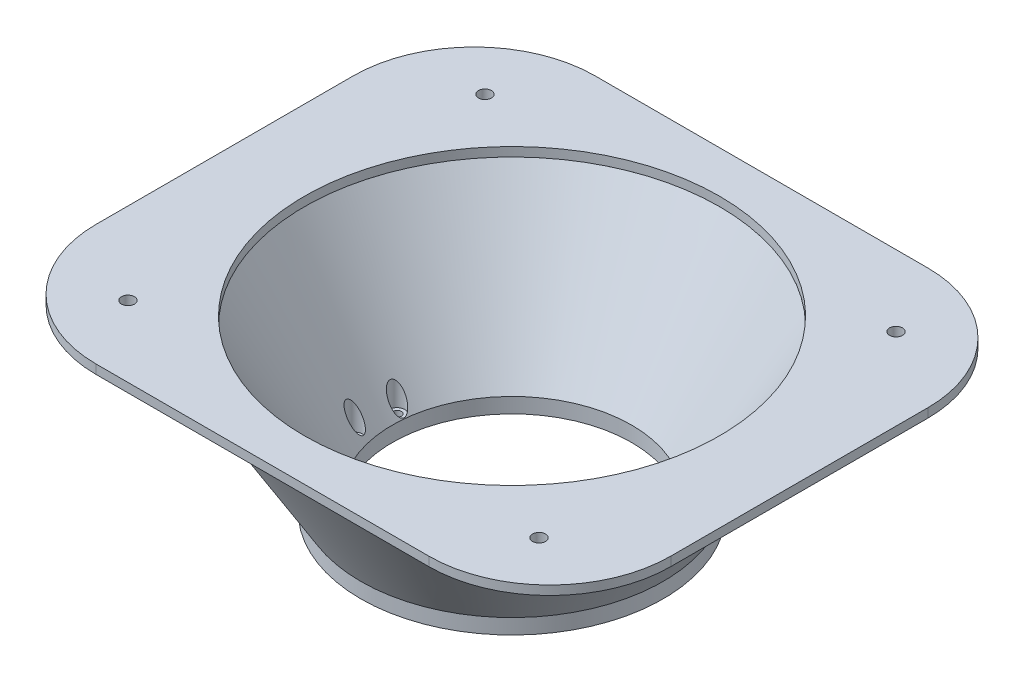
from build123d import *

# Parameters (mm, degrees)
SKETCH4_R           = 50
SKETCH4_R_2         = 39.565
SKETCH4_R_3         = 1.4
BOSS_EXTRUDE3_DEPTH = 5
SKETCH7_W           = 190
SKETCH7_H           = 165
SKETCH7_R           = 68.628897091
SKETCH7_R_2         = 2.15
BOSS_EXTRUDE4_DEPTH = 3
FILLET1_R           = 40
CUT_EXTRUDE1_START  = -5
SKETCH8_R           = 2.5
CUT_EXTRUDE1_DEPTH  = 133.721639549


with BuildPart() as part:
    # Sketch4 → Boss-Extrude3 (new body)
    with BuildSketch(Plane(origin=(0, 0, 0), x_dir=(1, 0, 0), z_dir=(0, 1, 0))):
        Circle(SKETCH4_R)
        Circle(SKETCH4_R_2, mode=Mode.SUBTRACT)
        with Locations((42, -10)):
            Circle(SKETCH4_R_3, mode=Mode.SUBTRACT)
        with Locations((42, 4)):
            Circle(SKETCH4_R_3, mode=Mode.SUBTRACT)
        with Locations((-42, -10)):
            Circle(SKETCH4_R_3, mode=Mode.SUBTRACT)
        with Locations((-42, 4)):
            Circle(SKETCH4_R_3, mode=Mode.SUBTRACT)
    extrude(amount=BOSS_EXTRUDE3_DEPTH)

    # Sketch6 → Revolve1 (revolve)
    with BuildSketch(Plane(origin=(0, 0, 0), x_dir=(0, 0, -1), z_dir=(1, 0, 0))):
        Polygon((-50, 5), (-79.06281292, 53), (-68.62781292, 53), (-39.565, 5), align=None)
    revolve(axis=Axis((0, 0, 0), (0, 1, 0)))

    # Sketch7 → Boss-Extrude4 (add)
    with BuildSketch(Plane(origin=(0, 53, 0), x_dir=(1, 0, 0), z_dir=(0, 1, 0))):
        Rectangle(SKETCH7_W, SKETCH7_H)
        Circle(SKETCH7_R, mode=Mode.SUBTRACT)
        with Locations((-67.952980655, 59.01179899)):
            Circle(SKETCH7_R_2, mode=Mode.SUBTRACT)
        with Locations((67.952980655, 59.01179899)):
            Circle(SKETCH7_R_2, mode=Mode.SUBTRACT)
        with Locations((67.952980655, -59.01179899)):
            Circle(SKETCH7_R_2, mode=Mode.SUBTRACT)
        with Locations((-67.952980655, -59.01179899)):
            Circle(SKETCH7_R_2, mode=Mode.SUBTRACT)
    extrude(amount=BOSS_EXTRUDE4_DEPTH)

    # Fillet1
    fillet1_edges = [part.edges().sort_by_distance(p)[0] for p in [
        (95, 54.5, -82.5),
        (95, 54.5, 82.5),
        (-95, 54.5, 82.5),
        (-95, 54.5, -82.5),
    ]]
    fillet(fillet1_edges, radius=FILLET1_R)

    # Sketch8 → Cut-Extrude1 (cut, through all)
    with BuildSketch(Plane.XZ.offset(CUT_EXTRUDE1_START)):
        with Locations((42, 10)):
            Circle(SKETCH8_R)
        with Locations((42, -4)):
            Circle(SKETCH8_R)
        with Locations((-42, 10)):
            Circle(SKETCH8_R)
        with Locations((-42, -4)):
            Circle(SKETCH8_R)
    extrude(amount=-CUT_EXTRUDE1_DEPTH, mode=Mode.SUBTRACT)


solid = part.part
